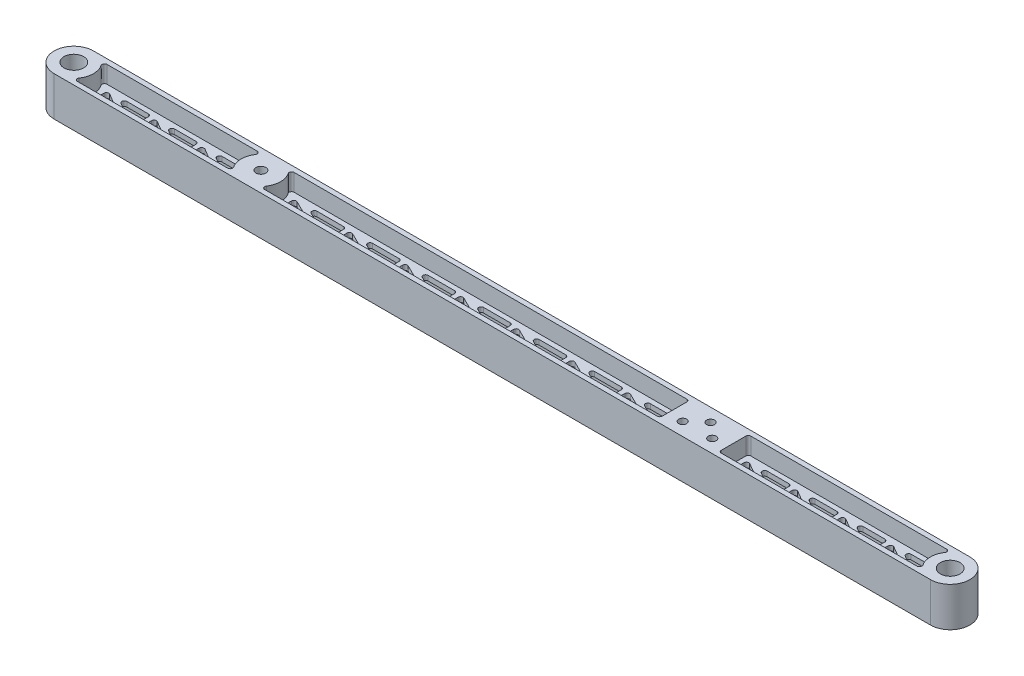
from build123d import *

# Parameters (mm, degrees)
SKETCH2_R                   = 6.35
SKETCH2_R_2                 = 3.175
BOSS_EXTRUDE1_DEPTH         = 25.4
CUT_EXTRUDE2_DEPTH          = 579.965406998
CUT_EXTRUDE3_START          = -11.1125
CUT_EXTRUDE3_DEPTH          = 11.1125
FILLET1_R                   = 1.5875
F_1_4_20_TAPPED_HOLE1_D     = 5.1054
F_1_4_20_TAPPED_HOLE1_DEPTH = 19.05
F_1_4_20_TAPPED_HOLE1_TIP   = 1.533816902


with BuildPart() as part:
    # Sketch2 → Boss-Extrude1 (new body)
    with BuildSketch(Plane(origin=(0, 0, 0), x_dir=(1, 0, 0), z_dir=(0, 1, 0))):
        with BuildLine():
            ThreePointArc((0, 25.4), (-12.7, 12.7), (0, 0))
            Line((0, 0), (565.15, 0))
            ThreePointArc((565.15, 0), (577.85, 12.7), (565.15, 25.4))
            Line((565.15, 25.4), (0, 25.4))
        make_face()
        with Locations((0, 12.7)):
            Circle(SKETCH2_R, mode=Mode.SUBTRACT)
        with Locations((120.65, 12.7)):
            Circle(SKETCH2_R_2, mode=Mode.SUBTRACT)
        with Locations((565.15, 12.7)):
            Circle(SKETCH2_R, mode=Mode.SUBTRACT)
    extrude(amount=BOSS_EXTRUDE1_DEPTH)

    # Sketch13 → Cut-Extrude2 (cut, through all)
    with BuildSketch(Plane(origin=(0, 25.4, 0), x_dir=(1, 0, 0), z_dir=(0, 1, 0))):
        Polygon((37.188969245, 6.35), (15.875, 19.05), (15.875, 6.35), align=None)
        Polygon((43.391666667, 19.05), (22.077697422, 19.05), (43.391666667, 6.35), align=None)
        Polygon((67.880635911, 6.35), (46.566666667, 19.05), (46.566666667, 6.35), align=None)
        Polygon((74.083333333, 19.05), (52.769364089, 19.05), (74.083333333, 6.35), align=None)
        Polygon((98.572302578, 6.35), (77.258333333, 19.05), (77.258333333, 6.35), align=None)
        Polygon((104.775, 19.05), (83.461030755, 19.05), (104.775, 6.35), align=None)
        Polygon((162.053809746, 6.35), (136.525, 19.05), (136.525, 6.35), align=None)
        Polygon((169.182142857, 19.05), (143.653333111, 19.05), (169.182142857, 6.35), align=None)
        Polygon((197.885952603, 6.35), (172.357142857, 19.05), (172.357142857, 6.35), align=None)
        Polygon((205.014285714, 19.05), (179.485475968, 19.05), (205.014285714, 6.35), align=None)
        Polygon((233.71809546, 6.35), (208.189285714, 19.05), (208.189285714, 6.35), align=None)
        Polygon((240.846428571, 19.05), (215.317618825, 19.05), (240.846428571, 6.35), align=None)
        Polygon((269.550238318, 6.35), (244.021428571, 19.05), (244.021428571, 6.35), align=None)
        Polygon((276.678571429, 19.05), (251.149761682, 19.05), (276.678571429, 6.35), align=None)
        Polygon((305.382381175, 6.35), (279.853571429, 19.05), (279.853571429, 6.35), align=None)
        Polygon((312.510714286, 19.05), (286.98190454, 19.05), (312.510714286, 6.35), align=None)
        Polygon((341.214524032, 6.35), (315.685714286, 19.05), (315.685714286, 6.35), align=None)
        Polygon((348.342857143, 19.05), (322.814047397, 19.05), (348.342857143, 6.35), align=None)
        Polygon((377.046666889, 6.35), (351.517857143, 19.05), (351.517857143, 6.35), align=None)
        Polygon((384.175, 19.05), (358.646190254, 19.05), (384.175, 6.35), align=None)
        Polygon((450.156724268, 6.35), (428.625, 19.05), (428.625, 6.35), align=None)
        Polygon((456.40625, 19.05), (434.874525732, 19.05), (456.40625, 6.35), align=None)
        Polygon((481.112974268, 6.35), (459.58125, 19.05), (459.58125, 6.35), align=None)
        Polygon((487.3625, 19.05), (465.830775732, 19.05), (487.3625, 6.35), align=None)
        Polygon((512.069224268, 6.35), (490.5375, 19.05), (490.5375, 6.35), align=None)
        Polygon((518.31875, 19.05), (496.787025732, 19.05), (518.31875, 6.35), align=None)
        Polygon((543.025474268, 6.35), (521.49375, 19.05), (521.49375, 6.35), align=None)
        Polygon((549.275, 19.05), (527.743275732, 19.05), (549.275, 6.35), align=None)
    extrude(amount=-CUT_EXTRUDE2_DEPTH, mode=Mode.SUBTRACT)

    # Sketch13<4> → Cut-Extrude3 (cut)
    # profile 1 of 3: a face of its own
    with BuildSketch(Plane(origin=(0, 25.4, 0), x_dir=(1, 0, 0), z_dir=(0, 1, 0)).offset(CUT_EXTRUDE3_START)):
        with BuildLine():
            ThreePointArc((556.749739587, 3.175), (552.45, 12.7), (556.749739587, 22.225))
            Line((556.749739587, 22.225), (425.45, 22.225))
            Line((425.45, 22.225), (425.45, 3.175))
            Line((425.45, 3.175), (556.749739587, 3.175))
        make_face()
        Polygon((428.625, 6.35), (428.625, 19.05), (450.156724268, 6.35), align=None, mode=Mode.SUBTRACT)
        Polygon((456.40625, 6.35), (434.874525732, 19.05), (456.40625, 19.05), align=None, mode=Mode.SUBTRACT)
        Polygon((459.58125, 6.35), (459.58125, 19.05), (481.112974268, 6.35), align=None, mode=Mode.SUBTRACT)
        Polygon((487.3625, 6.35), (465.830775732, 19.05), (487.3625, 19.05), align=None, mode=Mode.SUBTRACT)
        Polygon((490.5375, 6.35), (490.5375, 19.05), (512.069224268, 6.35), align=None, mode=Mode.SUBTRACT)
        Polygon((518.31875, 6.35), (496.787025732, 19.05), (518.31875, 19.05), align=None, mode=Mode.SUBTRACT)
        Polygon((521.49375, 6.35), (521.49375, 19.05), (543.025474268, 6.35), align=None, mode=Mode.SUBTRACT)
        Polygon((549.275, 6.35), (527.743275732, 19.05), (549.275, 19.05), align=None, mode=Mode.SUBTRACT)
    # profile 2 of 3: a face of its own
    with BuildSketch(Plane(origin=(0, 25.4, 0), x_dir=(1, 0, 0), z_dir=(0, 1, 0)).offset(CUT_EXTRUDE3_START)):
        with BuildLine():
            Line((387.35, 3.175), (387.35, 22.225))
            Line((387.35, 22.225), (129.050260413, 22.225))
            ThreePointArc((129.050260413, 22.225), (133.35, 12.7), (129.050260413, 3.175))
            Line((129.050260413, 3.175), (387.35, 3.175))
        make_face()
        Polygon((136.525, 6.35), (136.525, 19.05), (162.053809746, 6.35), align=None, mode=Mode.SUBTRACT)
        Polygon((169.182142857, 6.35), (143.653333111, 19.05), (169.182142857, 19.05), align=None, mode=Mode.SUBTRACT)
        Polygon((172.357142857, 6.35), (172.357142857, 19.05), (197.885952603, 6.35), align=None, mode=Mode.SUBTRACT)
        Polygon((205.014285714, 6.35), (179.485475968, 19.05), (205.014285714, 19.05), align=None, mode=Mode.SUBTRACT)
        Polygon((208.189285714, 6.35), (208.189285714, 19.05), (233.71809546, 6.35), align=None, mode=Mode.SUBTRACT)
        Polygon((240.846428571, 6.35), (215.317618825, 19.05), (240.846428571, 19.05), align=None, mode=Mode.SUBTRACT)
        Polygon((244.021428571, 6.35), (244.021428571, 19.05), (269.550238318, 6.35), align=None, mode=Mode.SUBTRACT)
        Polygon((276.678571429, 6.35), (251.149761682, 19.05), (276.678571429, 19.05), align=None, mode=Mode.SUBTRACT)
        Polygon((279.853571429, 6.35), (279.853571429, 19.05), (305.382381175, 6.35), align=None, mode=Mode.SUBTRACT)
        Polygon((312.510714286, 6.35), (286.98190454, 19.05), (312.510714286, 19.05), align=None, mode=Mode.SUBTRACT)
        Polygon((315.685714286, 6.35), (315.685714286, 19.05), (341.214524032, 6.35), align=None, mode=Mode.SUBTRACT)
        Polygon((348.342857143, 6.35), (322.814047397, 19.05), (348.342857143, 19.05), align=None, mode=Mode.SUBTRACT)
        Polygon((351.517857143, 6.35), (351.517857143, 19.05), (377.046666889, 6.35), align=None, mode=Mode.SUBTRACT)
        Polygon((384.175, 6.35), (358.646190254, 19.05), (384.175, 19.05), align=None, mode=Mode.SUBTRACT)
    # profile 3 of 3: a face of its own
    with BuildSketch(Plane(origin=(0, 25.4, 0), x_dir=(1, 0, 0), z_dir=(0, 1, 0)).offset(CUT_EXTRUDE3_START)):
        with BuildLine():
            ThreePointArc((112.249739587, 3.175), (107.95, 12.7), (112.249739587, 22.225))
            Line((112.249739587, 22.225), (8.400260413, 22.225))
            ThreePointArc((8.400260413, 22.225), (12.7, 12.7), (8.400260413, 3.175))
            Line((8.400260413, 3.175), (112.249739587, 3.175))
        make_face()
        Polygon((15.875, 6.35), (15.875, 19.05), (37.188969245, 6.35), align=None, mode=Mode.SUBTRACT)
        Polygon((43.391666667, 6.35), (22.077697422, 19.05), (43.391666667, 19.05), align=None, mode=Mode.SUBTRACT)
        Polygon((46.566666667, 6.35), (46.566666667, 19.05), (67.880635911, 6.35), align=None, mode=Mode.SUBTRACT)
        Polygon((74.083333333, 6.35), (52.769364089, 19.05), (74.083333333, 19.05), align=None, mode=Mode.SUBTRACT)
        Polygon((77.258333333, 6.35), (77.258333333, 19.05), (98.572302578, 6.35), align=None, mode=Mode.SUBTRACT)
        Polygon((104.775, 6.35), (83.461030755, 19.05), (104.775, 19.05), align=None, mode=Mode.SUBTRACT)
    cut_extrude3 = extrude(amount=CUT_EXTRUDE3_DEPTH, mode=Mode.SUBTRACT)

    # Mirror1: Cut-Extrude3 across plane
    add(cut_extrude3.mirror(Plane(origin=(0, 12.7, 0), x_dir=(0, 0, 1), z_dir=(0, -1, 0))), mode=Mode.SUBTRACT)

    # Fillet1
    fillet1_edges = [part.edges().sort_by_distance(p)[0] for p in [
        (104.775, 12.7, -19.05),
        (83.461030755, 12.7, -19.05),
        (98.572302578, 12.7, -6.35),
        (77.258333333, 12.7, -6.35),
        (77.258333333, 12.7, -19.05),
        (74.083333333, 12.7, -19.05),
        (74.083333333, 12.7, -6.35),
        (52.769364089, 12.7, -19.05),
        (67.880635911, 12.7, -6.35),
        (46.566666667, 12.7, -6.35),
        (46.566666667, 12.7, -19.05),
        (43.391666667, 12.7, -19.05),
        (43.391666667, 12.7, -6.35),
        (22.077697422, 12.7, -19.05),
        (37.188969245, 12.7, -6.35),
        (15.875, 12.7, -6.35),
        (15.875, 12.7, -19.05),
        (104.775, 12.7, -6.35),
        (384.175, 12.7, -19.05),
        (358.646190254, 12.7, -19.05),
        (377.046666889, 12.7, -6.35),
        (351.517857143, 12.7, -6.35),
        (351.517857143, 12.7, -19.05),
        (348.342857143, 12.7, -19.05),
        (348.342857143, 12.7, -6.35),
        (322.814047397, 12.7, -19.05),
        (341.214524032, 12.7, -6.35),
        (315.685714286, 12.7, -6.35),
        (315.685714286, 12.7, -19.05),
        (312.510714286, 12.7, -19.05),
        (312.510714286, 12.7, -6.35),
        (286.98190454, 12.7, -19.05),
        (305.382381175, 12.7, -6.35),
        (279.853571429, 12.7, -6.35),
        (279.853571429, 12.7, -19.05),
        (276.678571429, 12.7, -19.05),
        (276.678571429, 12.7, -6.35),
        (251.149761682, 12.7, -19.05),
        (269.550238318, 12.7, -6.35),
        (244.021428571, 12.7, -6.35),
        (244.021428571, 12.7, -19.05),
        (240.846428571, 12.7, -19.05),
        (240.846428571, 12.7, -6.35),
        (215.317618825, 12.7, -19.05),
        (233.71809546, 12.7, -6.35),
        (208.189285714, 12.7, -6.35),
        (208.189285714, 12.7, -19.05),
        (205.014285714, 12.7, -19.05),
        (205.014285714, 12.7, -6.35),
        (179.485475968, 12.7, -19.05),
        (197.885952603, 12.7, -6.35),
        (172.357142857, 12.7, -6.35),
        (172.357142857, 12.7, -19.05),
        (169.182142857, 12.7, -19.05),
        (169.182142857, 12.7, -6.35),
        (143.653333111, 12.7, -19.05),
        (162.053809746, 12.7, -6.35),
        (136.525, 12.7, -6.35),
        (136.525, 12.7, -19.05),
        (384.175, 12.7, -6.35),
        (112.249739587, 5.55625, -22.225),
        (112.249739587, 5.55625, -3.175),
        (8.400260413, 5.55625, -3.175),
        (8.400260413, 5.55625, -22.225),
        (387.35, 5.55625, -22.225),
        (129.050260413, 5.55625, -3.175),
        (129.050260413, 5.55625, -22.225),
        (387.35, 5.55625, -3.175),
        (425.45, 19.84375, -22.225),
        (425.45, 19.84375, -3.175),
        (556.749739587, 19.84375, -3.175),
        (112.249739587, 19.84375, -3.175),
        (112.249739587, 19.84375, -22.225),
        (8.400260413, 19.84375, -22.225),
        (8.400260413, 19.84375, -3.175),
        (387.35, 19.84375, -3.175),
        (387.35, 19.84375, -22.225),
        (129.050260413, 19.84375, -22.225),
        (129.050260413, 19.84375, -3.175),
        (556.749739587, 19.84375, -22.225),
        (549.275, 12.7, -6.35),
        (527.743275732, 12.7, -19.05),
        (543.025474268, 12.7, -6.35),
        (521.49375, 12.7, -6.35),
        (521.49375, 12.7, -19.05),
        (518.31875, 12.7, -19.05),
        (518.31875, 12.7, -6.35),
        (496.787025732, 12.7, -19.05),
        (512.069224268, 12.7, -6.35),
        (490.5375, 12.7, -6.35),
        (490.5375, 12.7, -19.05),
        (487.3625, 12.7, -19.05),
        (487.3625, 12.7, -6.35),
        (465.830775732, 12.7, -19.05),
        (481.112974268, 12.7, -6.35),
        (459.58125, 12.7, -6.35),
        (459.58125, 12.7, -19.05),
        (456.40625, 12.7, -19.05),
        (456.40625, 12.7, -6.35),
        (434.874525732, 12.7, -19.05),
        (450.156724268, 12.7, -6.35),
        (428.625, 12.7, -6.35),
        (428.625, 12.7, -19.05),
        (549.275, 12.7, -19.05),
        (556.749739587, 5.55625, -22.225),
        (425.45, 5.55625, -22.225),
        (425.45, 5.55625, -3.175),
        (556.749739587, 5.55625, -3.175),
    ]]
    fillet(fillet1_edges, radius=FILLET1_R)

    # 1/4-20 Tapped Hole1
    with Locations(Plane(origin=(396.875, 25.4, -8.466666667), x_dir=(0, 0, 1), z_dir=(0, 1, 0))):
        with Locations((0, 0), (0, 19.05), (-8.466666666, 9.525)):
            Hole(F_1_4_20_TAPPED_HOLE1_D / 2, depth=F_1_4_20_TAPPED_HOLE1_DEPTH)
            with Locations((0, 0, -(F_1_4_20_TAPPED_HOLE1_DEPTH + F_1_4_20_TAPPED_HOLE1_TIP / 2))):  # 118° drill point
                Cone(0, F_1_4_20_TAPPED_HOLE1_D / 2, F_1_4_20_TAPPED_HOLE1_TIP, mode=Mode.SUBTRACT)


solid = part.part
